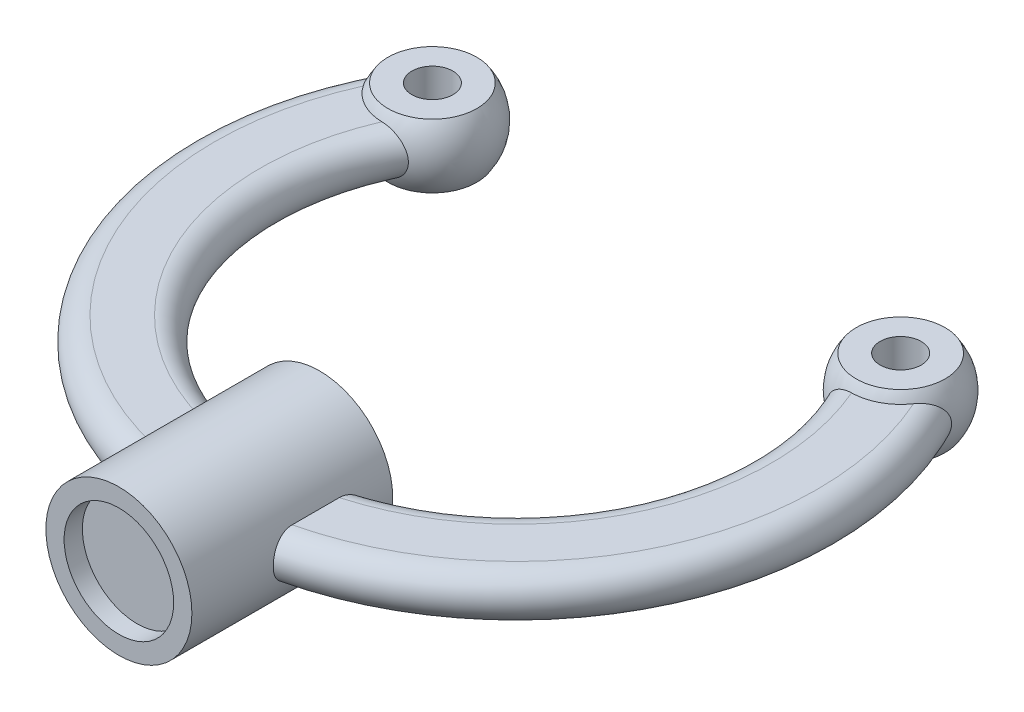
from build123d import *

# Parameters (mm, degrees)
SKETCH7_W                = 138.667181603
SKETCH7_H                = 62.252300273
CUT_EXTRUDE4_DEPTH       = 156.470254523
SKETCH8_W                = 150.818962898
SKETCH8_H                = 56.532407254
CUT_EXTRUDE5_DEPTH       = 156.470254523
SKETCH12_R               = 4.5
CUT_EXTRUDE6_DEPTH       = 156.470254523
CUT_EXTRUDE7_DEPTH       = 155.770798414
CUT_EXTRUDE7_DEPTH_BACK  = 155.770798414
BOSS_EXTRUDE2_DEPTH      = 21
BOSS_EXTRUDE2_DEPTH_BACK = 23
SKETCH14_R               = 16
SKETCH16_R               = 12
CUT_EXTRUDE8_DEPTH       = 151.734866628
SKETCH17_W               = 14
SKETCH17_H               = 2


with BuildPart() as part:
    # Sketch1 → Revolve1 (revolve)
    with BuildSketch(Plane(origin=(0, 0, 0), x_dir=(0, 0, -1), z_dir=(1, 0, 0))):
        with BuildLine():
            Line((0, 5), (10, 5))
            ThreePointArc((10, 5), (15, 0), (10, -5))
            Line((10, -5), (0, -5))
            ThreePointArc((0, -5), (-5, 0), (0, 5))
        make_face()
    revolve(axis=Axis((0, 16.0008336, -66), (0, -1, 0)))


with BuildPart() as body_2:
    # Sketch2 → Revolve2 (revolve)
    with BuildSketch(Plane(origin=(0, 0, 0), x_dir=(1, 0, 0), z_dir=(0, 1, 0))):
        with BuildLine():
            Line((-61.395418997, 105.491803279), (-41.21062371, 92.508196721))
            ThreePointArc((-41.21062371, 92.508196721), (-57.794824632, 88.907602357), (-61.395418997, 105.491803279))
        make_face()
    revolve(axis=Axis((-51.303021354, 0, -99), (-0.841033136942994, 0, -0.5409836065573772)))


with BuildPart() as body_3:
    # Sketch9 → Revolve4 (revolve)
    with BuildSketch(Plane(origin=(0, 0, 0), x_dir=(1, 0, 0), z_dir=(0, 1, 0))):
        with BuildLine():
            Line((39.303021354, 99), (63.303021354, 99))
            ThreePointArc((63.303021354, 99), (51.303021354, 111), (39.303021354, 99))
        make_face()
    revolve(axis=Axis((39.303021354, 0, -99), (1, 0, 0)))


with BuildPart() as cut_extrude4_tool:
    # Sketch7 → Cut-Extrude4 (new, through all)
    with BuildSketch(Plane(origin=(0, 7, 0), x_dir=(1, 0, 0), z_dir=(0, 1, 0))):
        with Locations((-1.666409198, 97.126150137)):
            Rectangle(SKETCH7_W, SKETCH7_H)
    extrude(amount=CUT_EXTRUDE4_DEPTH)


with BuildPart() as body_2_1:
    add(body_2.part)

    # Cut-Extrude4: cut by cut_extrude4_tool
    add(cut_extrude4_tool.part, mode=Mode.SUBTRACT)


with BuildPart() as body_3_1:
    add(body_3.part)

    # Cut-Extrude4: cut by cut_extrude4_tool
    add(cut_extrude4_tool.part, mode=Mode.SUBTRACT)


with BuildPart() as cut_extrude5_tool:
    # Sketch8 → Cut-Extrude5 (new, through all)
    with BuildSketch(Plane(origin=(0, -7, 0), x_dir=(-1, 0, 0), z_dir=(0, -1, 0))):
        with Locations((5.180962211, 94.961669782)):
            Rectangle(SKETCH8_W, SKETCH8_H)
    extrude(amount=CUT_EXTRUDE5_DEPTH)


with BuildPart() as body_2_2:
    add(body_2_1.part)

    # Cut-Extrude5: cut by cut_extrude5_tool
    add(cut_extrude5_tool.part, mode=Mode.SUBTRACT)


with BuildPart() as body_3_2:
    add(body_3_1.part)

    # Cut-Extrude5: cut by cut_extrude5_tool
    add(cut_extrude5_tool.part, mode=Mode.SUBTRACT)


with BuildPart() as cut_extrude6_tool:
    # Sketch12 → Cut-Extrude6 (new, through all)
    with BuildSketch(Plane(origin=(0, 7, 0), x_dir=(1, 0, 0), z_dir=(0, 1, 0))):
        with Locations((-51.303021354, 99)):
            Circle(SKETCH12_R)
        with Locations((51.303021354, 99)):
            Circle(SKETCH12_R)
    extrude(amount=-CUT_EXTRUDE6_DEPTH)


with BuildPart() as part_1:
    add(part.part)

    # Cut-Extrude6: cut by cut_extrude6_tool
    add(cut_extrude6_tool.part, mode=Mode.SUBTRACT)

    # Sketch13 → Cut-Extrude7 (cut, two sides: drawn at the far end of the back side and taken through both)
    with BuildSketch(Plane(origin=(0, 0, 0), x_dir=(1, 0, 0), z_dir=(0, 1, 0)).offset(-CUT_EXTRUDE7_DEPTH_BACK)):
        Polygon((0, 66), (-51.303021354, 99), (-118.585672309, 142.278688525), (118.585672309, 142.278688525), (51.303021354, 99), align=None)
    extrude(amount=CUT_EXTRUDE7_DEPTH + CUT_EXTRUDE7_DEPTH_BACK, mode=Mode.SUBTRACT)

    # Sketch14 → Boss-Extrude2 (add, two sides: drawn at the far end of the back side and taken through both)
    with BuildSketch(Plane.XY.offset(-BOSS_EXTRUDE2_DEPTH_BACK)):
        Circle(SKETCH14_R)
    extrude(amount=BOSS_EXTRUDE2_DEPTH + BOSS_EXTRUDE2_DEPTH_BACK)

    # Sketch16 → Cut-Extrude8 (cut, through all)
    with BuildSketch(Plane.XY.offset(21)):
        Circle(SKETCH16_R)
    extrude(amount=-CUT_EXTRUDE8_DEPTH, mode=Mode.SUBTRACT)

    # Sketch17 → Revolve5 (revolve)
    with BuildSketch(Plane(origin=(0, 0, 0), x_dir=(1, 0, 0), z_dir=(0, 1, 0))):
        with Locations((-7, -16)):
            Rectangle(SKETCH17_W, SKETCH17_H)
    revolve(axis=Axis((0, 0, 0), (0, 0, 1)))


with BuildPart() as body_2_3:
    add(body_2_2.part)

    # Cut-Extrude6: cut by cut_extrude6_tool
    add(cut_extrude6_tool.part, mode=Mode.SUBTRACT)


with BuildPart() as body_3_3:
    add(body_3_2.part)

    # Cut-Extrude6: cut by cut_extrude6_tool
    add(cut_extrude6_tool.part, mode=Mode.SUBTRACT)


with BuildPart() as body_2_4:
    add(body_2_3.part)

    # Combine1: union body 3, part
    add(body_3_3.part)
    add(part_1.part)


solid = body_2_4.part
